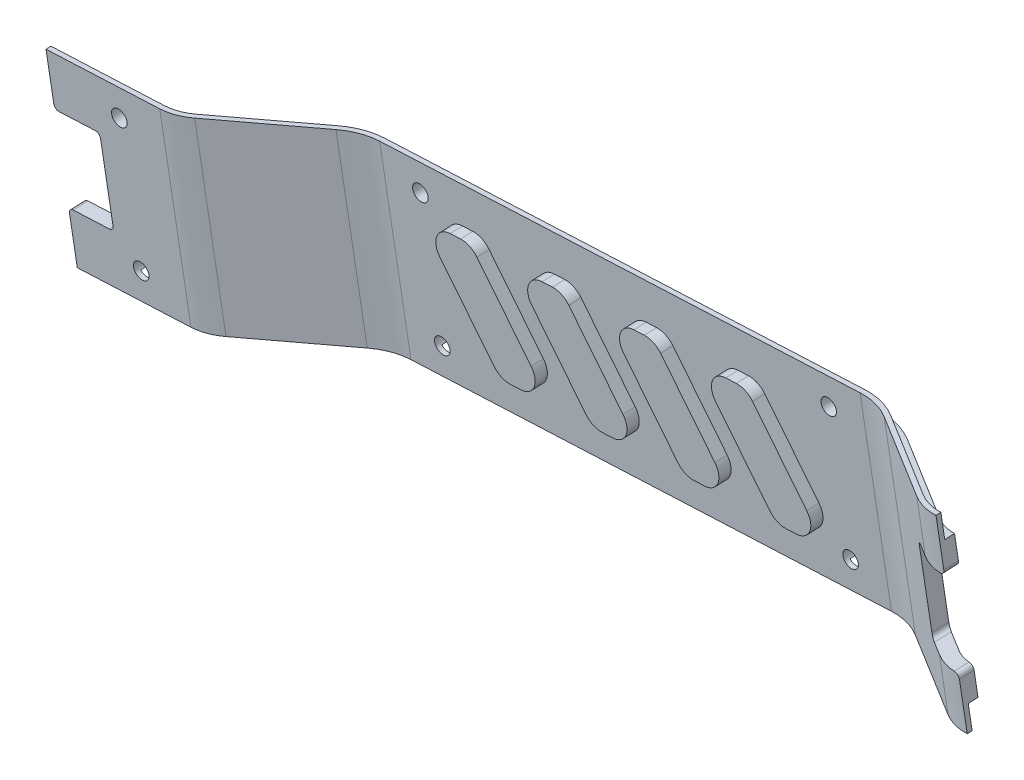
from build123d import *

# Parameters (mm, degrees)
EXTRUDE_1_DEPTH     = 40
CUT_EXTRUDE_1_DEPTH = 5
SKETCH_5_R          = 1.6999999999576394
SKETCH_5_R_2        = 1.6999999999576927
CUT_EXTRUDE_2_DEPTH = 10
SKETCH_6_R          = 1.7000000000438593
CUT_EXTRUDE_3_DEPTH = 55
CUT_EXTRUDE_4_DEPTH = 0.8
EXTRUDE_2_DEPTH     = 2.5
EXTRUDE_3_DEPTH     = 2.5
FILLET_1_R          = 2.2
CUT_EXTRUDE_5_DEPTH = 10
FILLET_2_R          = 1
CUT_EXTRUDE_6_DEPTH = 10
FILLET_3_R          = 1


with BuildPart() as part:
    # 草图2 → 凸台-拉伸1 (new body)
    with BuildSketch(Plane(origin=(-35.95282664063553, 399.742426838025, 30.566209896759094), x_dir=(0.9960030029050828, 0.08905977205298463, 0.006809934355634681), z_dir=(-0.0893197525973826, 0.9931039643902263, 0.0759374591908285))):
        with BuildLine():
            Line((491.2634983965815, -1135.8025581881004), (472.38632236797133, -1123.9958225354637))
            ThreePointArc((472.38632236797133, -1123.9958225354637), (468.8237875839068, -1122.370484391492), (464.9619747625342, -1121.7225801527334))
            Line((464.9619747625342, -1121.7225801527334), (358.52458764430776, -1117.961189900255))
            ThreePointArc((358.52458764430776, -1117.961189900255), (354.6266729474563, -1118.334873169868), (350.9582928201078, -1119.7046780505693))
            Line((350.9582928201078, -1119.7046780505693), (331.29477179485195, -1130.1494242167382))
            ThreePointArc((331.29477179485195, -1130.1494242167382), (328.36006769297313, -1131.2452681212994), (325.24173593549193, -1131.5442147369897))
            Line((325.24173593549193, -1131.5442147369897), (302.5392732323506, -1130.7419325292913))
            Line((302.5392732323506, -1130.7419325292913), (302.64522407883385, -1127.7438040433638))
            Line((302.64522407883385, -1127.7438040433638), (325.34768678197526, -1128.5460862510622))
            ThreePointArc((325.34768678197526, -1128.5460862510622), (327.6864356000861, -1128.3218762892946), (329.8874636764952, -1127.4999933608735))
            Line((329.8874636764952, -1127.4999933608735), (349.5509847017511, -1117.0552471947046))
            ThreePointArc((349.5509847017511, -1117.0552471947046), (353.9530408545694, -1115.411481337863), (358.63053849079114, -1114.9630614143275))
            Line((358.63053849079114, -1114.9630614143275), (465.06792560901744, -1118.7244516668059))
            ThreePointArc((465.06792560901744, -1118.7244516668059), (469.70210099466453, -1119.5019367533164), (473.97714273554203, -1121.4523425260825))
            Line((473.97714273554203, -1121.4523425260825), (492.85431876415225, -1133.2590781787192))
            ThreePointArc((492.85431876415225, -1133.2590781787192), (494.991839634591, -1134.2342810651023), (497.3089273274145, -1134.6230236083575))
            Line((497.3089273274145, -1134.6230236083575), (497.20297648093117, -1137.621152094285))
            ThreePointArc((497.20297648093117, -1137.621152094285), (494.1135262238331, -1137.102828703278), (491.2634983965815, -1135.8025581881004))
        make_face()
    extrude(amount=-EXTRUDE_1_DEPTH)

    # 草图3 → 切除-拉伸1 (cut)
    with BuildSketch(Plane(origin=(-35.95282664063558, 399.74242683802527, 30.566209896759155), x_dir=(0.9960030029050828, 0.08905977205298465, 0.0068099343556346816), z_dir=(-0.08931975259738263, 0.9931039643902263, 0.07593745919082856))):
        with BuildLine():
            Line((472.9165958238281, -1123.1479958656705), (491.7937718524383, -1134.9547315183067))
            ThreePointArc((491.7937718524383, -1134.9547315183067), (494.40629736075226, -1136.1466461572195), (497.23829342975876, -1136.6217759323094))
            Line((497.23829342975876, -1136.6217759323094), (497.3089273274144, -1134.6230236083582))
            ThreePointArc((497.3089273274144, -1134.6230236083582), (494.99183963459086, -1134.2342810651026), (492.85431876415214, -1133.2590781787194))
            Line((492.85431876415214, -1133.2590781787194), (473.9771427355419, -1121.452342526083))
            ThreePointArc((473.9771427355419, -1121.452342526083), (469.7021009946644, -1119.5019367533168), (465.0679256090173, -1118.7244516668063))
            Line((465.0679256090173, -1118.7244516668063), (358.6305384907911, -1114.963061414328))
            ThreePointArc((358.6305384907911, -1114.963061414328), (353.9530408545694, -1115.4114813378635), (349.550984701751, -1117.0552471947049))
            Line((349.550984701751, -1117.0552471947049), (329.8874636764952, -1127.499993360874))
            ThreePointArc((329.8874636764952, -1127.499993360874), (327.6864356000861, -1128.321876289295), (325.34768678197526, -1128.5460862510627))
            Line((325.34768678197526, -1128.5460862510627), (302.6452240788338, -1127.7438040433642))
            Line((302.6452240788338, -1127.7438040433642), (302.5745901811783, -1129.742556367316))
            Line((302.5745901811783, -1129.742556367316), (325.2770528843197, -1130.5448385750144))
            ThreePointArc((325.2770528843197, -1130.5448385750144), (328.1355236620107, -1130.2708041772983), (330.82566908873304, -1129.2662805981174))
            Line((330.82566908873304, -1129.2662805981174), (350.48919011398885, -1118.8215344319483))
            ThreePointArc((350.48919011398885, -1118.8215344319483), (354.40212891649395, -1117.3604092258668), (358.55990459313546, -1116.9618137382797))
            Line((358.55990459313546, -1116.9618137382797), (464.9972917113618, -1120.7232039907578))
            ThreePointArc((464.9972917113618, -1120.7232039907578), (469.1165587208259, -1121.414301845434), (472.9165958238281, -1123.1479958656705))
        make_face()
    cut_extrude_1 = extrude(amount=-CUT_EXTRUDE_1_DEPTH, mode=Mode.SUBTRACT)

    # 草图5 → 切除-拉伸2 (cut)
    with BuildSketch(Plane(origin=(-38.749709268709985, -87.40103549159188, 1097.4452040064343), x_dir=(-0.9993811405079085, 0.002792573598671191, -0.035064761938564566), z_dir=(0.03517578708589478, 0.07933995566829587, -0.9962267991965689))):
        with Locations(Location((-458.86276991893226, 439.2871046820906, 0), (0, 0, 138.840464962))):
            Circle(SKETCH_5_R)
        with Locations(Location((-368.7211342546992, 431.1983193115409, 0), (0, 0, 138.840464962))):
            Circle(SKETCH_5_R_2)
    cut_extrude_2 = extrude(amount=-CUT_EXTRUDE_2_DEPTH, mode=Mode.SUBTRACT)

    # 草图6 → 切除-拉伸3 (cut)
    with BuildSketch(Plane(origin=(-39.37407948948843, -88.80931970470432, 1115.128229692172), x_dir=(0.9993811405079085, -0.002792573598671316, 0.035064761938565864), z_dir=(-0.035175787085896075, -0.07933995566829587, 0.9962267991965688))):
        with Locations(Location((318.14198563029277, 426.65964110326104, 0), (0, 0, 270))):
            Circle(SKETCH_6_R)
    cut_extrude_3 = extrude(amount=-CUT_EXTRUDE_3_DEPTH, mode=Mode.SUBTRACT)

    # 草图7 → 切除-拉伸4 (cut)
    with BuildSketch(Plane(origin=(-39.26855212823075, -88.57129983769946, 1112.1395492945824), x_dir=(-0.999381140507908, 0.0027925735986721626, -0.035064761938575745), z_dir=(0.035175787085906, 0.07933995566829677, -0.9962267991965684))):
        with BuildLine():
            Line((-323.17177573836045, 427.11098517243914), (-323.08240067515675, 428.10698321364197))
            Line((-323.08240067515675, 428.10698321364197), (-313.0228204590209, 427.2042950752856))
            Line((-313.0228204590209, 427.2042950752856), (-313.1121955222249, 426.208297034083))
            ThreePointArc((-313.1121955222249, 426.208297034083), (-318.59332969947064, 421.629850995193), (-323.17177573836045, 427.11098517243914))
        make_face()
    cut_extrude_4 = extrude(amount=-CUT_EXTRUDE_4_DEPTH, mode=Mode.SUBTRACT)

    # 镜向2: 切除-拉伸1, 切除-拉伸2, 切除-拉伸3, 切除-拉伸4 across plane
    add(cut_extrude_1.mirror(Plane(origin=(-34.16643158868864, 379.8803475502187, 29.0474607129423), x_dir=(0.006802356310068284, -0.07563217342500189, 0.9971125825560729), z_dir=(-0.08931975259738496, 0.9931039643902261, 0.07593745919082813))), mode=Mode.SUBTRACT)
    add(cut_extrude_2.mirror(Plane(origin=(-34.16643158868864, 379.8803475502187, 29.0474607129423), x_dir=(0.006802356310068284, -0.07563217342500189, 0.9971125825560729), z_dir=(-0.08931975259738496, 0.9931039643902261, 0.07593745919082813))), mode=Mode.SUBTRACT)
    add(cut_extrude_3.mirror(Plane(origin=(-34.16643158868864, 379.8803475502187, 29.0474607129423), x_dir=(0.006802356310068284, -0.07563217342500189, 0.9971125825560729), z_dir=(-0.08931975259738496, 0.9931039643902261, 0.07593745919082813))), mode=Mode.SUBTRACT)
    add(cut_extrude_4.mirror(Plane(origin=(-34.16643158868864, 379.8803475502187, 29.0474607129423), x_dir=(0.006802356310068284, -0.07563217342500189, 0.9971125825560729), z_dir=(-0.08931975259738496, 0.9931039643902261, 0.07593745919082813))), mode=Mode.SUBTRACT)

    # 草图8 → 凸台-拉伸2 (add)
    with BuildSketch(Plane(origin=(340.7041041256277, 29.54314693432754, 14.382756020657332), x_dir=(-0.041862751009763305, -0.0036300044207878395, 0.9991167765310518), z_dir=(-0.9953816583596617, -0.08631157133877962, -0.042019838816925247))):
        Polygon((1141.0557553421606, 281.607292024501), (1143.049970277987, 281.45528284804726), (1142.6699473368526, 276.46974550848074), (1143.6670548047655, 276.3937409202541), (1146.7072383338414, 316.27803963678684), (1145.7101308659287, 316.3540442250139), (1145.3301079247944, 311.3685068854474), (1143.335892988967, 311.5205160619013), align=None)
    extrude(amount=EXTRUDE_2_DEPTH)

    # 草图9 → 凸台-拉伸3 (add)
    with BuildSketch(Plane(origin=(-38.85523662996759, -87.63905535859669, 1100.4338844040237), x_dir=(0.9993811405079085, -0.0027925735986713833, 0.03506476193856667), z_dir=(-0.03517578708589689, -0.07933995566829606, 0.9962267991965688))):
        with BuildLine():
            Line((435.8978387433865, 429.2946230068501), (446.5284755498438, 414.1842658164183))
            ThreePointArc((446.5284755498438, 414.1842658164183), (448.0381172392712, 412.9232470583309), (449.97601467197103, 412.5859936238922))
            Line((449.97601467197103, 412.5859936238922), (452.2761736207712, 412.79239649108996))
            ThreePointArc((452.2761736207712, 412.79239649108996), (455.38408750272475, 414.97891685512974), (455.04446226255106, 418.7637094116957))
            Line((455.04446226255106, 418.7637094116957), (444.4138254560938, 433.87406660212747))
            ThreePointArc((444.4138254560938, 433.87406660212747), (442.9041837666664, 435.13508536021493), (440.9662863339665, 435.47233879465364))
            Line((440.9662863339665, 435.47233879465364), (438.6661273851663, 435.26593592745576))
            ThreePointArc((438.6661273851663, 435.26593592745576), (435.55821350321287, 433.079415563416), (435.8978387433865, 429.2946230068501))
        make_face()
        with BuildLine():
            Line((415.6125403891781, 427.47433848066345), (426.2431771956354, 412.36398129023166))
            ThreePointArc((426.2431771956354, 412.36398129023166), (427.7528188850627, 411.1029625321443), (429.69071631776256, 410.76570909770555))
            Line((429.69071631776256, 410.76570909770555), (431.9908752665628, 410.9721119649034))
            ThreePointArc((431.9908752665628, 410.9721119649034), (435.0987891485163, 413.1586323289431), (434.7591639083426, 416.94342488550905))
            Line((434.7591639083426, 416.94342488550905), (424.12852710188537, 432.05378207594083))
            ThreePointArc((424.12852710188537, 432.05378207594083), (422.618885412458, 433.3148008340283), (420.68098797975813, 433.652054268467))
            Line((420.68098797975813, 433.652054268467), (418.38082903095784, 433.4456514012692))
            ThreePointArc((418.38082903095784, 433.4456514012692), (415.27291514900435, 431.25913103722934), (415.6125403891781, 427.47433848066345))
        make_face()
        with BuildLine():
            Line((395.3272420349697, 425.6540539544768), (405.9578788414269, 410.5436967640451))
            ThreePointArc((405.9578788414269, 410.5436967640451), (407.4675205308543, 409.2826780059576), (409.40541796355416, 408.9454245715189))
            Line((409.40541796355416, 408.9454245715189), (411.70557691235445, 409.1518274387167))
            ThreePointArc((411.70557691235445, 409.1518274387167), (414.81349079430794, 411.3383478027565), (414.4738655541342, 415.1231403593224))
            Line((414.4738655541342, 415.1231403593224), (403.8432287476769, 430.23349754975413))
            ThreePointArc((403.8432287476769, 430.23349754975413), (402.3335870582496, 431.49451630784154), (400.3956896255497, 431.8317697422803))
            Line((400.3956896255497, 431.8317697422803), (398.0955306767495, 431.62536687508253))
            ThreePointArc((398.0955306767495, 431.62536687508253), (394.98761679479594, 429.43884651104275), (395.3272420349697, 425.6540539544768))
        make_face()
        with BuildLine():
            Line((375.0419436807612, 423.83376942829017), (385.6725804872185, 408.7234122378584))
            ThreePointArc((385.6725804872185, 408.7234122378584), (387.1822221766459, 407.462393479771), (389.12011960934575, 407.1251400453323))
            Line((389.12011960934575, 407.1251400453323), (391.420278558146, 407.33154291253004))
            ThreePointArc((391.420278558146, 407.33154291253004), (394.5281924400995, 409.5180632765699), (394.1885671999257, 413.3028558331358))
            Line((394.1885671999257, 413.3028558331358), (383.5579303934685, 428.41321302356755))
            ThreePointArc((383.5579303934685, 428.41321302356755), (382.0482887040411, 429.67423178165495), (380.11039127134126, 430.01148521609366))
            Line((380.11039127134126, 430.01148521609366), (377.810232322541, 429.8050823488959))
            ThreePointArc((377.810232322541, 429.8050823488959), (374.70231844058753, 427.6185619848561), (375.0419436807612, 423.83376942829017))
        make_face()
    extrude(amount=EXTRUDE_3_DEPTH)

    # 圆角1
    # the kernel refuses this fillet: 2.2 mm, written as the material it adds along each edge
    # the kernel refuses this fillet: 2.2 mm, written as the material it takes off along each edge
    with BuildSketch(Plane(origin=(283.7985788187413, 337.69875499545213, 1152.2251883258107), x_dir=(0.995381658359662, 0.08631157133876967, 0.04201983881693865), z_dir=(-0.035175787085906, -0.07933995566829677, 0.9962267991965684))) as fillet_1_2_piece_1:
        with BuildLine():
            CenterArc((2.100000000000258, -2.200000000000011), FILLET_1_R, 90.00000000000108, 80.47271661855797)
            Line((-0.06965517241359534, -1.8358620689659613), (-0.2866206896549839, -1.7994482758625276))
            ThreePointArc((-0.2866206896549839, -1.7994482758625276), (-0.21999999999969916, -1.0000000000014553), (-0.22000000000001083, 9.82e-15))
            Line((-0.22000000000001083, 9.82e-15), (-3.054e-14, 0.2199999999999962))
            Line((-3.054e-14, 0.2199999999999962), (2.1000000000001866, 0.21999999999999623))
            Line((2.1000000000001866, 0.21999999999999623), (2.100000000000217, 3e-17))
        make_face()
    extrude(amount=6.050000000000374, mode=Mode.SUBTRACT)
    with BuildSketch(Plane(origin=(273.7452240693087, 336.8270081249304, 1151.8007879537602), x_dir=(-0.9953816583596614, -0.08631157133877591, -0.04201983881693913), z_dir=(-0.035175787085906, -0.07933995566829677, 0.9962267991965684))) as fillet_1_2_piece_2:
        with BuildLine():
            CenterArc((2.0999999999998407, 2.200000000000011), FILLET_1_R, 189.52728338144252, 80.4727166185582)
            Line((-0.06965517241401131, 1.8358620689659018), (-0.28662068965540316, 1.7994482758624801))
            ThreePointArc((-0.28662068965540316, 1.7994482758624801), (-0.21999999999961758, 1.0000000000016411), (-0.2200000000000157, -4.525e-14))
            Line((-0.2200000000000157, -4.525e-14), (2.916e-14, -0.21999999999999623))
            Line((2.916e-14, -0.21999999999999623), (2.099999999999897, -0.2199999999999962))
            Line((2.099999999999897, -0.2199999999999962), (2.0999999999998678, 4e-17))
        make_face()
    extrude(amount=6.049999999999683, mode=Mode.SUBTRACT)
    with BuildSketch(Plane(origin=(276.4248166472305, 307.033889193222, 1149.5226641780353), x_dir=(-0.9953816583596619, -0.08631157133877111, -0.04201983881693876), z_dir=(-0.03517578708590602, -0.07933995566829645, 0.9962267991965684))) as fillet_1_2_piece_3:
        with BuildLine():
            CenterArc((2.1000000000000187, -2.200000000000011), FILLET_1_R, 90.000000000001, 80.47271661855746)
            Line((-0.06965517241382432, -1.8358620689659408), (-0.28662068965521276, -1.799448275862507))
            ThreePointArc((-0.28662068965521276, -1.799448275862507), (-0.21999999999938855, -1.0000000000012372), (-0.21999999999999637, 8.386e-14))
            Line((-0.21999999999999637, 8.386e-14), (-2.067e-14, 0.2200000000000135))
            Line((-2.067e-14, 0.2200000000000135), (2.0999999999999504, 0.21999999999999617))
            Line((2.0999999999999504, 0.21999999999999617), (2.099999999999981, 0))
        make_face()
    extrude(amount=6.049999999999683, mode=Mode.SUBTRACT)
    with BuildSketch(Plane(origin=(286.478171396663, 307.9056360637438, 1149.9470645500855), x_dir=(0.995381658359663, 0.08631157133875911, 0.042019838816937834), z_dir=(-0.03517578708590602, -0.07933995566829645, 0.9962267991965684))) as fillet_1_2_piece_4:
        with BuildLine():
            CenterArc((2.1000000000001995, 2.200000000000011), FILLET_1_R, 189.52728338144126, 80.47271661856041)
            Line((-0.06965517241368842, 1.8358620689659437), (-0.2866206896550797, 1.7994482758625185))
            ThreePointArc((-0.2866206896550797, 1.7994482758625185), (-0.2200000000003233, 1.0000000000015854), (-0.22000000000001083, 7.48e-15))
            Line((-0.22000000000001083, 7.48e-15), (2.333e-14, -0.2200000000000135))
            Line((2.333e-14, -0.2200000000000135), (2.100000000000297, -0.21999999999999623))
            Line((2.100000000000297, -0.21999999999999623), (2.100000000000264, 0))
        make_face()
    extrude(amount=6.0500000000006, mode=Mode.SUBTRACT)

    # 草图10 → 切除-拉伸5 (cut)
    with BuildSketch(Plane(origin=(-39.37407948948844, -88.80931970470435, 1115.1282296921722), x_dir=(0.9993811405079084, -0.0027925735986713356, 0.0350647619385661), z_dir=(-0.03517578708589632, -0.07933995566829598, 0.9962267991965689))):
        Polygon((303.43312308610604, 420.31966325358434), (305.0418742237709, 402.39169851195624), (315.0018546357865, 403.2854491439922), (313.39310349812166, 421.2134138856204), align=None)
    extrude(amount=-CUT_EXTRUDE_5_DEPTH, mode=Mode.SUBTRACT)

    # 圆角2
    fillet_2_edges = [part.edges().sort_by_distance(p)[0] for p in [
        (265.53178035556255, 311.57947010548713, 1156.2756194972187),
        (263.92402480880963, 329.45534146451115, 1157.6424937626534),
        (273.87784139240625, 330.318457177899, 1158.0626921508222),
        (275.4855969391591, 312.4425858188749, 1156.6958178853874),
    ]]
    fillet(fillet_2_edges, radius=FILLET_2_R)

    # 草图11 → 切除-拉伸6 (cut)
    with BuildSketch(Plane(origin=(-39.37407948948844, -88.80931970470434, 1115.128229692172), x_dir=(0.9993811405079084, -0.002792573598671336, 0.03506476193856611), z_dir=(-0.03517578708589632, -0.07933995566829595, 0.9962267991965688))):
        Polygon((489.96883303533264, 437.0582914202959), (491.5775841729975, 419.1303266786678), (501.53756458501306, 420.0240773107038), (499.92881344734826, 437.95204205233193), align=None)
    extrude(amount=-CUT_EXTRUDE_6_DEPTH, mode=Mode.SUBTRACT)

    # 圆角3
    fillet_3_edges = [part.edges().sort_by_distance(p)[0] for p in [
        (450.49024487614906, 345.9494160326059, 1161.3786969481307),
        (460.29811194691666, 346.48333860386487, 1165.9323868102738),
        (461.9058674936695, 328.60746724484073, 1164.5655125448388),
        (452.0980004229019, 328.07354467358186, 1160.0118226826958),
    ]]
    fillet(fillet_3_edges, radius=FILLET_3_R)


solid = part.part
